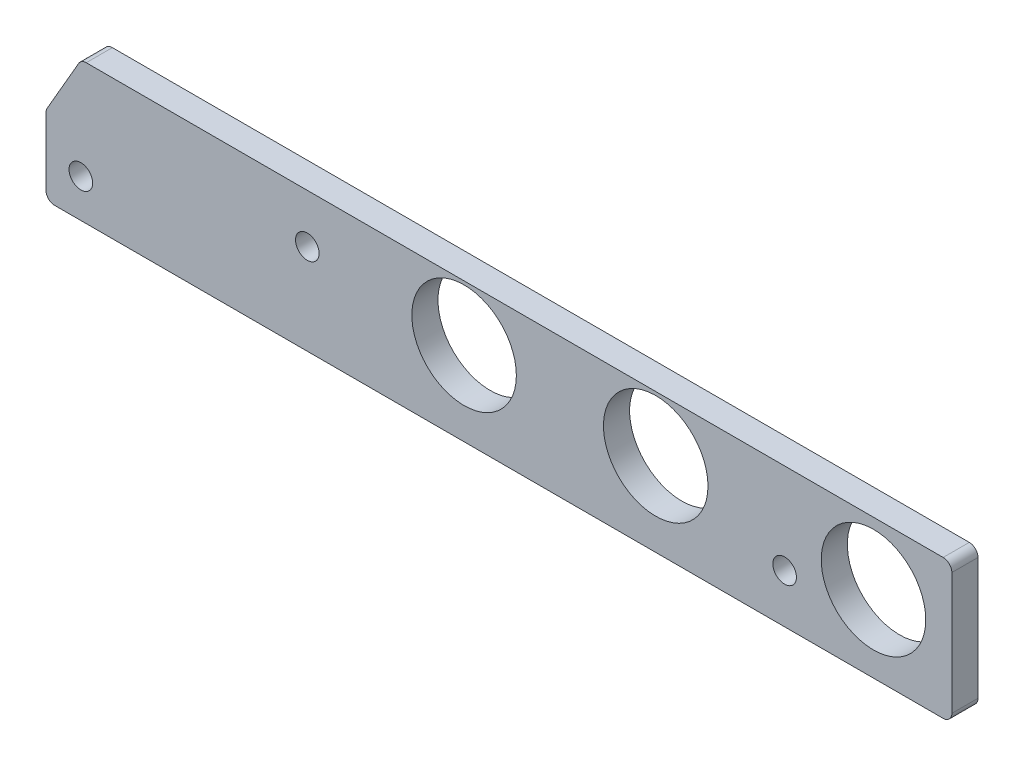
from build123d import *

# Parameters (mm, degrees)
BOSS_EXTRUDE1_DEPTH         = 4.7625
F_6_CLEARANCE_HOLE1_D       = 4.3053
F_3_4_0_75_DIAMETER_HOLE1_D = 19.05


with BuildPart() as part:
    # Sketch1 → Boss-Extrude1 (new body)
    with BuildSketch(Plane.XY):
        with BuildLine():
            Line((-159.14246691, -0.79375), (-164.887315329, -10.744119343))
            ThreePointArc((-164.887315329, -10.744119343), (-165.045907249, -11.126994109), (-165.1, -11.537869343))
            Line((-165.1, -11.537869343), (-165.1, -23.8125))
            ThreePointArc((-165.1, -23.8125), (-164.635032015, -24.935032015), (-163.5125, -25.4))
            Line((-163.5125, -25.4), (-1.5875, -25.4))
            ThreePointArc((-1.5875, -25.4), (-0.464967985, -24.935032015), (0, -23.8125))
            Line((0, -23.8125), (0, -1.5875))
            ThreePointArc((0, -1.5875), (-0.464967985, -0.464967985), (-1.5875, 0))
            Line((-1.5875, 0), (-157.767651581, 0))
            ThreePointArc((-157.767651581, 0), (-158.561401581, -0.212684671), (-159.14246691, -0.79375))
        make_face()
    extrude(amount=BOSS_EXTRUDE1_DEPTH)

    # #6 Clearance Hole1 (through all)
    with Locations(Plane.XY.offset(4.7625)):
        with Locations((-158.75, -18.415), (-117.475, -8.89), (-30.48, -16.51)):
            Hole(F_6_CLEARANCE_HOLE1_D / 2)

    # 3/4 (0.75) Diameter Hole1 (through all)
    with Locations(Plane.XY.offset(4.7625)):
        with Locations((-88.9, -10.16), (-53.975, -10.16), (-14.2875, -11.43)):
            Hole(F_3_4_0_75_DIAMETER_HOLE1_D / 2)


solid = part.part
